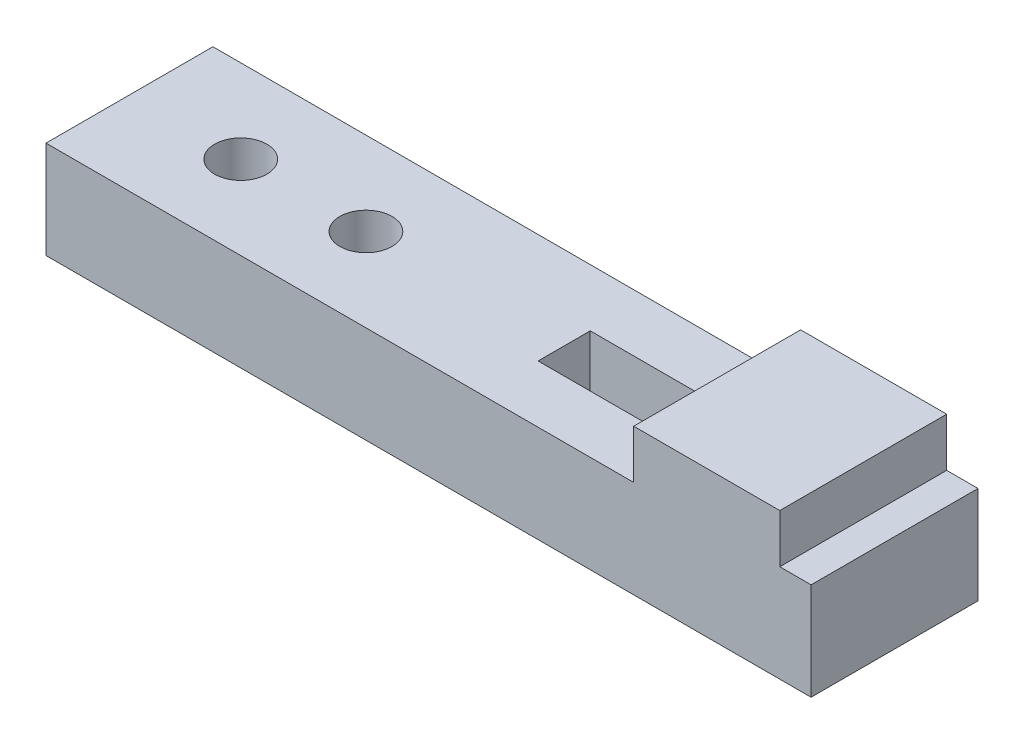
from build123d import *

# Parameters (mm, degrees)
F_01_BASE_PROFILE_W           = 220
F_01_BASE_PROFILE_H           = 48
F_01_BASE_PROFILE_R           = 7.5
F_01_BASE_PROFILE_W_2         = 60
F_01_BASE_PROFILE_H_2         = 15
F_01_BASE_EXTRUDE_DEPTH       = 28
F_02_BOSS_PROFILE_W           = 42
F_02_BOSS_PROFILE_H           = 48
F_02_REINFORCEMENT_BOSS_DEPTH = 42


with BuildPart() as part:
    # 01_Base_Profile → 01_Base_Extrude (new body)
    with BuildSketch(Plane(origin=(0, 0, 0), x_dir=(1, 0, 0), z_dir=(0, 1, 0))):
        Rectangle(F_01_BASE_PROFILE_W, F_01_BASE_PROFILE_H)
        with Locations((-78, 0)):
            Circle(F_01_BASE_PROFILE_R, mode=Mode.SUBTRACT)
        with Locations((-42, 0)):
            Circle(F_01_BASE_PROFILE_R, mode=Mode.SUBTRACT)
        with Locations((45, 0)):
            Rectangle(F_01_BASE_PROFILE_W_2, F_01_BASE_PROFILE_H_2, mode=Mode.SUBTRACT)
    extrude(amount=F_01_BASE_EXTRUDE_DEPTH)

    # 02_Boss_Profile → 02_Reinforcement_Boss (add)
    with BuildSketch(Plane(origin=(0, 0, 0), x_dir=(1, 0, 0), z_dir=(0, 1, 0))):
        with Locations((80, 0)):
            Rectangle(F_02_BOSS_PROFILE_W, F_02_BOSS_PROFILE_H)
    extrude(amount=F_02_REINFORCEMENT_BOSS_DEPTH)


solid = part.part
